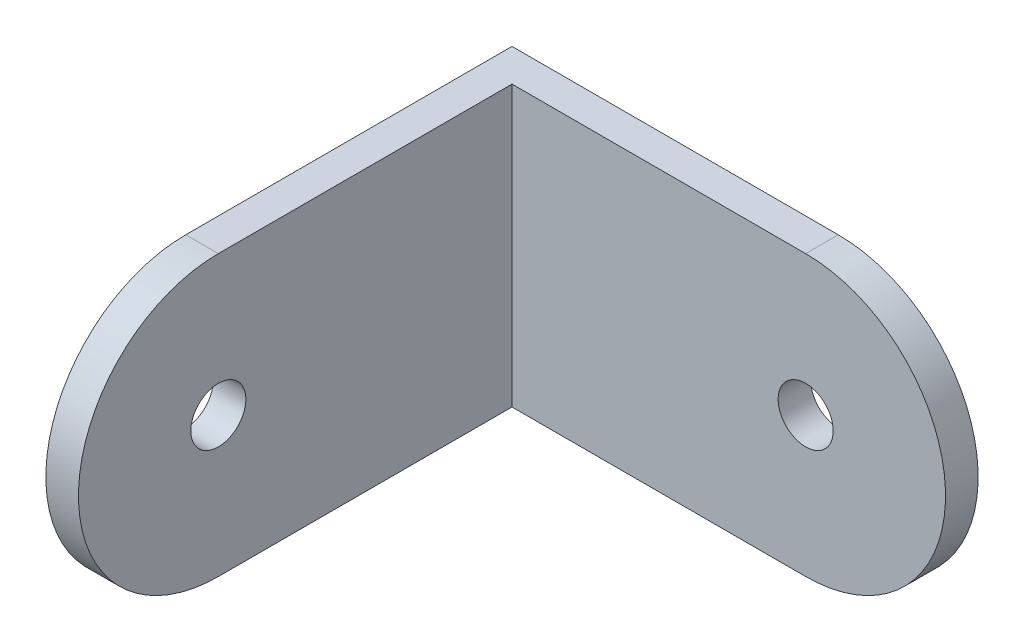
from build123d import *

# Parameters (mm, degrees)
SKETCH1_R           = 1.5
BOSS_EXTRUDE1_DEPTH = 1.778
SKETCH2_R           = 1.5
BOSS_EXTRUDE2_DEPTH = 1.778


with BuildPart() as part:
    # Sketch1 → Boss-Extrude1 (new body)
    with BuildSketch(Plane.XY):
        with BuildLine():
            Line((0, 7.62), (-17.78, 7.62))
            Line((-17.78, 7.62), (-17.78, -7.62))
            Line((-17.78, -7.62), (0, -7.62))
            ThreePointArc((0, -7.62), (7.62, 0), (0, 7.62))
        make_face()
        Circle(SKETCH1_R, mode=Mode.SUBTRACT)
    extrude(amount=BOSS_EXTRUDE1_DEPTH)

    # Sketch2 → Boss-Extrude2 (add)
    with BuildSketch(Plane.ZY.offset(17.78)):
        with BuildLine():
            Line((0, 7.62), (17.78, 7.62))
            ThreePointArc((17.78, 7.62), (25.4, 0), (17.78, -7.62))
            Line((17.78, -7.62), (0, -7.62))
            Line((0, -7.62), (0, 7.62))
        make_face()
        with Locations((17.78, 0)):
            Circle(SKETCH2_R, mode=Mode.SUBTRACT)
    extrude(amount=-BOSS_EXTRUDE2_DEPTH)


solid = part.part
